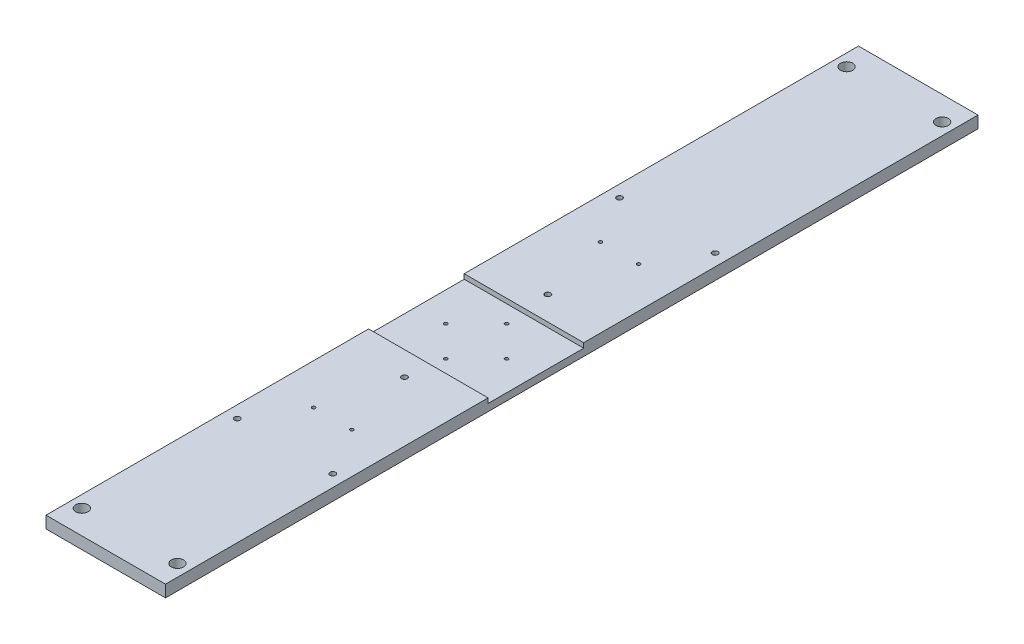
from build123d import *

# Parameters (mm, degrees)
SKETCH1_W           = 63.5
SKETCH1_H           = 431.8
BOSS_EXTRUDE1_DEPTH = 6.35
SKETCH6_R           = 3.2639
CUT_EXTRUDE9_DEPTH  = 437.490334945
SKETCH7_R           = 1.4732
CUT_EXTRUDE10_DEPTH = 437.490334945
SKETCH8_R           = 0.889
CUT_EXTRUDE11_DEPTH = 437.490334945
SKETCH9_W           = 63.5
SKETCH9_H           = 50.8
CUT_EXTRUDE12_DEPTH = 2.54


with BuildPart() as part:
    # Sketch1 → Boss-Extrude1 (new body)
    with BuildSketch(Plane(origin=(0, 0, 0), x_dir=(1, 0, 0), z_dir=(0, 1, 0))):
        with Locations((31.75, 215.9)):
            Rectangle(SKETCH1_W, SKETCH1_H)
    extrude(amount=BOSS_EXTRUDE1_DEPTH)

    # Sketch6 → Cut-Extrude9 (cut, through all)
    with BuildSketch(Plane(origin=(0, 6.35, 0), x_dir=(1, 0, 0), z_dir=(0, 1, 0))):
        with Locations((6.35, 419.1)):
            Circle(SKETCH6_R)
        with Locations((57.15, 419.1)):
            Circle(SKETCH6_R)
        with Locations((57.15, 12.7)):
            Circle(SKETCH6_R)
        with Locations((6.35, 12.7)):
            Circle(SKETCH6_R)
    extrude(amount=-CUT_EXTRUDE9_DEPTH, mode=Mode.SUBTRACT)

    # Sketch7 → Cut-Extrude10 (cut, through all)
    with BuildSketch(Plane(origin=(0, 6.35, 0), x_dir=(1, 0, 0), z_dir=(0, 1, 0))):
        with Locations((6.35, 298.45)):
            Circle(SKETCH7_R)
        with Locations((57.15, 298.45)):
            Circle(SKETCH7_R)
        with Locations((57.15, 95.25)):
            Circle(SKETCH7_R)
        with Locations((6.35, 95.25)):
            Circle(SKETCH7_R)
        with Locations((31.75, 234.95)):
            Circle(SKETCH7_R)
        with Locations((31.75, 158.75)):
            Circle(SKETCH7_R)
    extrude(amount=-CUT_EXTRUDE10_DEPTH, mode=Mode.SUBTRACT)

    # Sketch8 → Cut-Extrude11 (cut, through all)
    with BuildSketch(Plane(origin=(0, 6.35, 0), x_dir=(1, 0, 0), z_dir=(0, 1, 0))):
        with Locations((15.58544, 196.85)):
            Circle(SKETCH8_R)
        with Locations((31.75, 213.01456)):
            Circle(SKETCH8_R)
        with Locations((47.91456, 196.85)):
            Circle(SKETCH8_R)
        with Locations((31.75, 180.68544)):
            Circle(SKETCH8_R)
        with Locations((21.59, 273.05)):
            Circle(SKETCH8_R)
        with Locations((41.91, 273.05)):
            Circle(SKETCH8_R)
        with Locations((41.91, 120.65)):
            Circle(SKETCH8_R)
        with Locations((21.59, 120.65)):
            Circle(SKETCH8_R)
    extrude(amount=-CUT_EXTRUDE11_DEPTH, mode=Mode.SUBTRACT)

    # Sketch9 → Cut-Extrude12 (cut)
    with BuildSketch(Plane(origin=(0, 6.35, 0), x_dir=(1, 0, 0), z_dir=(0, 1, 0))):
        with Locations((31.75, 196.85)):
            Rectangle(SKETCH9_W, SKETCH9_H)
    extrude(amount=-CUT_EXTRUDE12_DEPTH, mode=Mode.SUBTRACT)


solid = part.part
